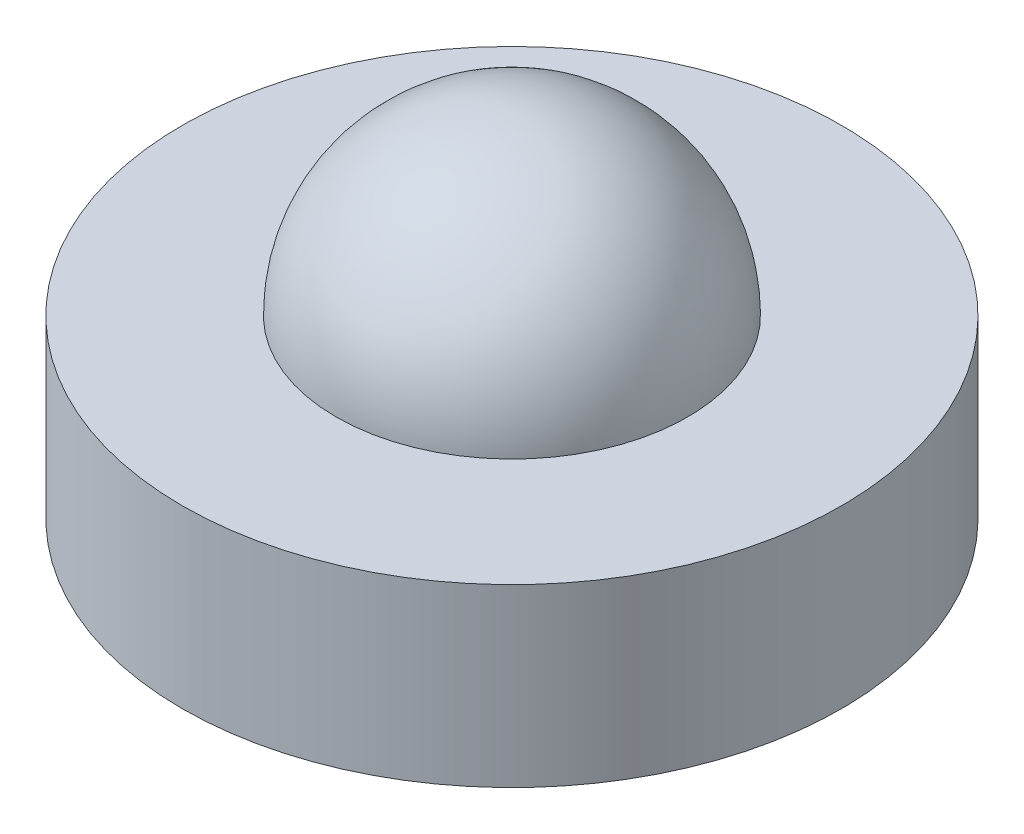
from build123d import *

# Parameters (mm, degrees)
SKETCH1_R               = 3.75
BOSS_EXTRUDE1_DEPTH     = 2
CUT_EXTRUDE1_DEPTH      = 7.642665128
CUT_EXTRUDE1_DEPTH_BACK = 7.642665128
SKETCH3_W               = 4
SKETCH3_H               = 2


with BuildPart() as part:
    # Sketch1 → Boss-Extrude1 (new body)
    with BuildSketch(Plane(origin=(0, 0, 0), x_dir=(1, 0, 0), z_dir=(0, 1, 0))):
        Circle(SKETCH1_R)
    extrude(amount=BOSS_EXTRUDE1_DEPTH)


with BuildPart() as body_2:
    # Sketch2 → Revolve6 (revolve)
    with BuildSketch(Plane(origin=(0, 2, 0), x_dir=(1, 0, 0), z_dir=(0, 1, 0))):
        with BuildLine():
            Line((-2, 0), (2, 0))
            ThreePointArc((2, 0), (0, 2), (-2, 0))
        make_face()
    revolve(axis=Axis((2.864015087, 2, 0), (1, 0, 0)))

    # Sketch3 → Cut-Extrude1 (cut, two sides: drawn at the far end of the back side and taken through both)
    with BuildSketch(Plane.XY.offset(-CUT_EXTRUDE1_DEPTH_BACK)):
        with Locations((0, 1)):
            Rectangle(SKETCH3_W, SKETCH3_H)
    extrude(amount=CUT_EXTRUDE1_DEPTH + CUT_EXTRUDE1_DEPTH_BACK, mode=Mode.SUBTRACT)


solid = Compound([part.part, body_2.part])
